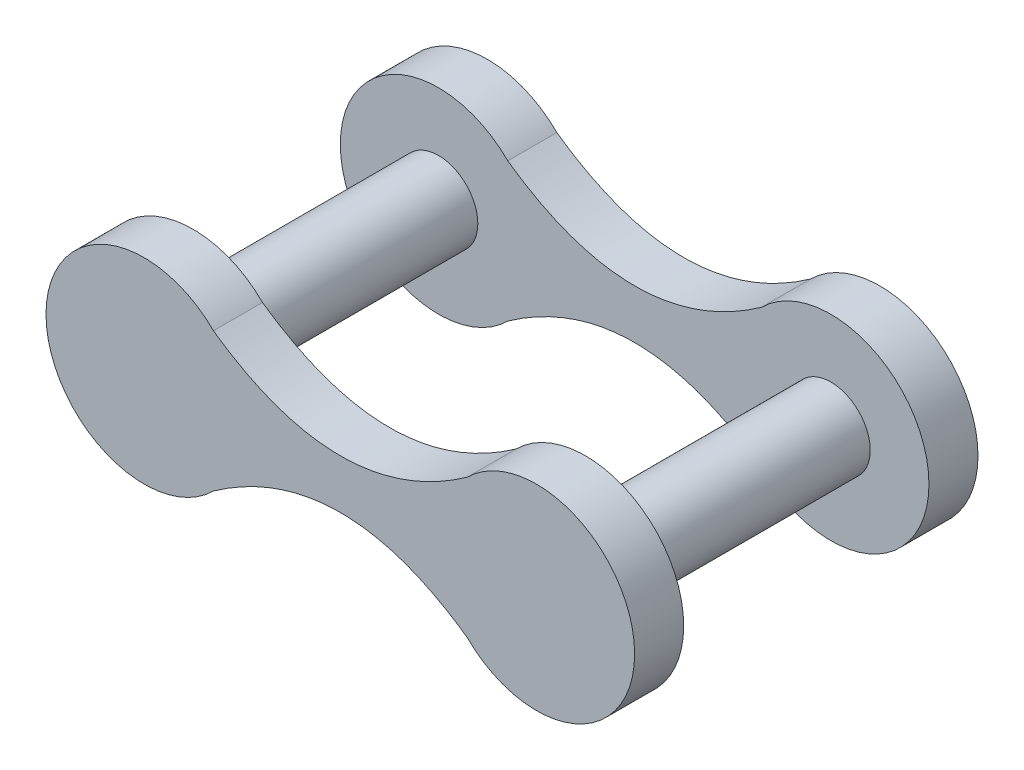
from build123d import *

# Parameters (mm, degrees)
BOSS_EXTRUDE1_DEPTH = 1.5875
SKETCH2_R           = 1.275343429
BOSS_EXTRUDE2_DEPTH = 7.9375
SCALE1_SCALE        = 0.75


with BuildPart() as part:
    # Sketch1 → Boss-Extrude1 (new body)
    with BuildSketch(Plane.XY):
        with BuildLine():
            ThreePointArc((-4.10493597, 2.24506403), (-9.525, 0), (-4.10493597, -2.24506403))
            add(Edge.make_bspline(
                [(-4.10493597, -2.24506403), (0, 0.65756403), (4.10493597, -2.24506403)],
                knots=[0, 0, 0, 1, 1, 1], degree=2))
            ThreePointArc((4.10493597, -2.24506403), (9.525, 0), (4.10493597, 2.24506403))
            add(Edge.make_bspline(
                [(-4.10493597, 2.24506403), (0, -0.65756403), (4.10493597, 2.24506403)],
                knots=[0, 0, 0, 1, 1, 1], degree=2))
        make_face()
    boss_extrude1 = extrude(amount=BOSS_EXTRUDE1_DEPTH)

    # Sketch2 → Boss-Extrude2 (add)
    with BuildSketch(Plane.XY.offset(1.5875)):
        with Locations((-6.35, 0)):
            Circle(SKETCH2_R)
        with Locations((6.35, 0)):
            Circle(SKETCH2_R)
    extrude(amount=BOSS_EXTRUDE2_DEPTH)

    # Mirror1: Boss-Extrude1 across plane
    add(boss_extrude1.mirror(Plane.XY.offset(5.55625)))


with BuildPart() as part_1:
    # Scale1: scaled about (0, 0, 5.55625)
    add(part.part.scale(SCALE1_SCALE).moved(Location((0, 0, 1.3890625))))


solid = part_1.part
